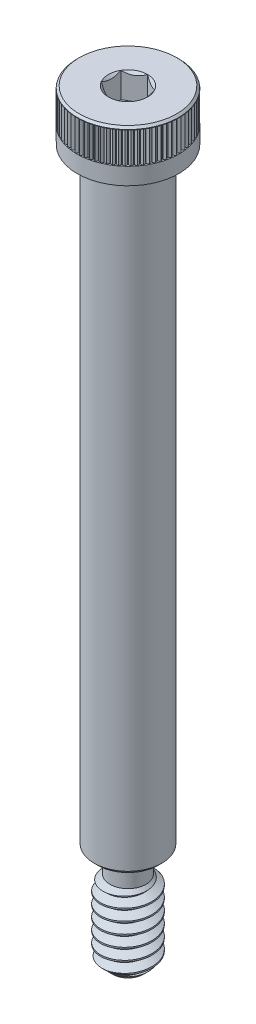
from build123d import *

# Parameters (mm, degrees)
SKETCH1_R          = 4.7625
EXTRUDE1_DEPTH     = 4.7625
CUT_EXTRUDE1_DEPTH = 2.38125
SKETCH4_R          = 3.175
EXTRUDE2_DEPTH     = 57.15
SKETCH5_R          = 2.413
EXTRUDE3_DEPTH     = 9.525
CHAMFER1_SIZE      = 0.9525
CUT_SWEEP1_PITCH   = 1.058333333
CUT_SWEEP1_TO      = 9.525
CUT_EXTRUDE3_DEPTH = 2.941919045
CHAMFER2_SIZE      = 0.194234129
CIRPATTERN2_COUNT  = 72
FILLET1_R          = 0.529166667
CHAMFER3_SIZE      = 0.352777778


with BuildPart() as part:
    # Sketch1 → Extrude1 (new body)
    with BuildSketch(Plane(origin=(0, 0, 0), x_dir=(1, 0, 0), z_dir=(0, 1, 0))):
        with Locations(Location((0, 0, 0), (0, 0, 90))):
            Circle(SKETCH1_R)
    extrude(amount=EXTRUDE1_DEPTH)

    # Sketch2 → Cut-Extrude1 (cut)
    with BuildSketch(Plane(origin=(0, 4.7625, 0), x_dir=(-1, 0, 0), z_dir=(0, 1, 0))):
        Polygon((0, -1.833087105), (1.5875, -0.916543552), (1.5875, 0.916543552), (0, 1.833087105), (-1.5875, 0.916543552), (-1.5875, -0.916543552), align=None)
    extrude(amount=-CUT_EXTRUDE1_DEPTH, mode=Mode.SUBTRACT)

    # Sketch4 → Extrude2 (add)
    with BuildSketch(Plane.XZ):
        with Locations(Location((0, 0, 0), (0, 0, 90))):
            Circle(SKETCH4_R)
    extrude(amount=EXTRUDE2_DEPTH)

    # Sketch5 → Extrude3 (add)
    with BuildSketch(Plane.XZ.offset(57.15)):
        with Locations(Location((0, 0, 0), (0, 0, 90))):
            Circle(SKETCH5_R)
    extrude(amount=EXTRUDE3_DEPTH)

    # Chamfer1
    chamfer1_edges = [part.edges().sort_by_distance(p)[0] for p in [
        (0, -66.675, -2.413),
    ]]
    chamfer(chamfer1_edges, length=CHAMFER1_SIZE)

    # Cut-Sweep1: arcs per turn and ends read off the stored shape
    # Cut-Sweep1: the profile of Sketch13 profile screwed along a right-hand helix through 11 turns, 6 arcs to a turn; built about Z, then put on its axis
    cut_sweep1_z = Axis((0, 0, 0), (0, 0, 1))
    cut_sweep1_corners = [(2.4133, 0, -0.132118462), (2.4133, 0, -1.058506538), (1.725592336, 0, -0.661458333), (1.725592336, 0, -0.529166667)]
    with BuildLine(mode=Mode.PRIVATE) as cut_sweep1_profile:
        Line(cut_sweep1_corners[0], cut_sweep1_corners[1])
        Line(cut_sweep1_corners[1], cut_sweep1_corners[2])
        Line(cut_sweep1_corners[2], cut_sweep1_corners[3])
        Line(cut_sweep1_corners[3], cut_sweep1_corners[0])
    cut_sweep1_cap = Face(cut_sweep1_profile.wire())
    cut_sweep1_turn_angles = [0, 30, 60, 90, 120, 150, 180, 210, 240, 270, 300, 330, 360]
    cut_sweep1_turn_weights = [1, 0.8660254037844387, 1, 0.8660254037844387, 1, 0.8660254037844387, 1, 0.8660254037844387, 1, 0.8660254037844387, 1, 0.8660254037844387, 1]
    cut_sweep1_turn_rails = [Edge.make_bspline([Vector(p[0], p[1], 0).rotate(cut_sweep1_z, cut_sweep1_turn_angles[k]) / cut_sweep1_turn_weights[k] + Vector(0, 0, p[2] + CUT_SWEEP1_PITCH * cut_sweep1_turn_angles[k] / 360) for k in range(13)], [0, 0, 0, 1, 1, 2, 2, 3, 3, 4, 4, 5, 5, 6, 6, 6], 2, cut_sweep1_turn_weights) for p in cut_sweep1_corners]
    cut_sweep1_turn_sides = [Face.make_surface_from_curves(cut_sweep1_turn_rails[p[0]], cut_sweep1_turn_rails[p[1]]) for p in [(0, 1), (1, 2), (2, 3), (3, 0)]]
    cut_sweep1 = Plane(origin=(0, -66.675, 0), x_dir=(0.7071067811865439, 0, 0.7071067811865512), z_dir=(0, 1, 0)) * split(Solid(Shell([*[p.moved(Location((0, 0, CUT_SWEEP1_PITCH * i))) for i in range(11) for p in cut_sweep1_turn_sides], cut_sweep1_cap, cut_sweep1_cap.rotate(cut_sweep1_z, 3960).moved(Location((0, 0, CUT_SWEEP1_PITCH * 3960 / 360)))])), bisect_by=Plane.XY.offset(CUT_SWEEP1_TO), keep=Keep.BOTTOM, mode=Mode.PRIVATE)
    add(cut_sweep1, mode=Mode.SUBTRACT)

    # Sketch18 → Cut-Revolve1 (revolve, cut)
    with BuildSketch(Plane.XY, mode=Mode.PRIVATE) as cut_revolve1_sk:
        Polygon((2.413, -57.15), (1.6891, -57.15), (1.6891, -59.2582), (2.413, -59.9821), align=None)
    revolve(cut_revolve1_sk.sketch.rotate(Axis((0, -57.15, 0), (0, 1, 0)), 90), axis=Axis((0, -57.15, 0), (0, 1, 0)), mode=Mode.SUBTRACT)

    # Sketch10 → Cut-Extrude3 (cut)
    with BuildSketch(Plane(origin=(0, 1.5875, 0), x_dir=(-1, 0, 0), z_dir=(0, 1, 0))):
        with BuildLine():
            Line((-4.757967155, -0.207737332), (-4.827695013, -0.210781716))
            Line((-4.827695013, -0.210781716), (-4.827695013, 0.210781716))
            Line((-4.827695013, 0.210781716), (-4.757967155, 0.207737332))
            Line((-4.757967155, 0.207737332), (-4.581019282, 0.030789459))
            ThreePointArc((-4.581019282, 0.030789459), (-4.568265871, 0), (-4.581019282, -0.030789459))
            Line((-4.581019282, -0.030789459), (-4.757967155, -0.207737332))
        make_face()
    cut_extrude3 = extrude(amount=CUT_EXTRUDE3_DEPTH, mode=Mode.SUBTRACT)

    # Chamfer2
    chamfer2_edges = [part.edges().sort_by_distance(p)[0] for p in [
        (0, 4.7625, 4.7625),
    ]]
    chamfer(chamfer2_edges, length=CHAMFER2_SIZE)

    # CirPattern2: Cut-Extrude3 ×72 about axis
    cirpattern2_axis = Axis((0, 0, 0), (0, 1, 0))
    for i in range(1, CIRPATTERN2_COUNT):
        add(cut_extrude3.rotate(cirpattern2_axis, i * 360 / CIRPATTERN2_COUNT), mode=Mode.SUBTRACT)

    # Fillet1
    fillet1_edges = [part.edges().sort_by_distance(p)[0] for p in [
        (0, -57.15, 1.6891),
    ]]
    fillet(fillet1_edges, radius=FILLET1_R)

    # Chamfer3
    chamfer3_edges = [part.edges().sort_by_distance(p)[0] for p in [
        (0, -57.15, -3.175),
    ]]
    chamfer(chamfer3_edges, length=CHAMFER3_SIZE)

    # Extrude4 cone 1 section (through the dimple's axis) → Extrude4 (revolve, cut)
    with BuildSketch(Plane(origin=(0, 4.7625, 0), x_dir=(0, 0, 1), z_dir=(1, 0, 0))):
        Polygon((0, 0), (1.833087105, 0), (0, 1.833087105), align=None)
    revolve(axis=Axis((0, 4.7625, 0), (0, -1, 0)), mode=Mode.SUBTRACT)


solid = part.part
